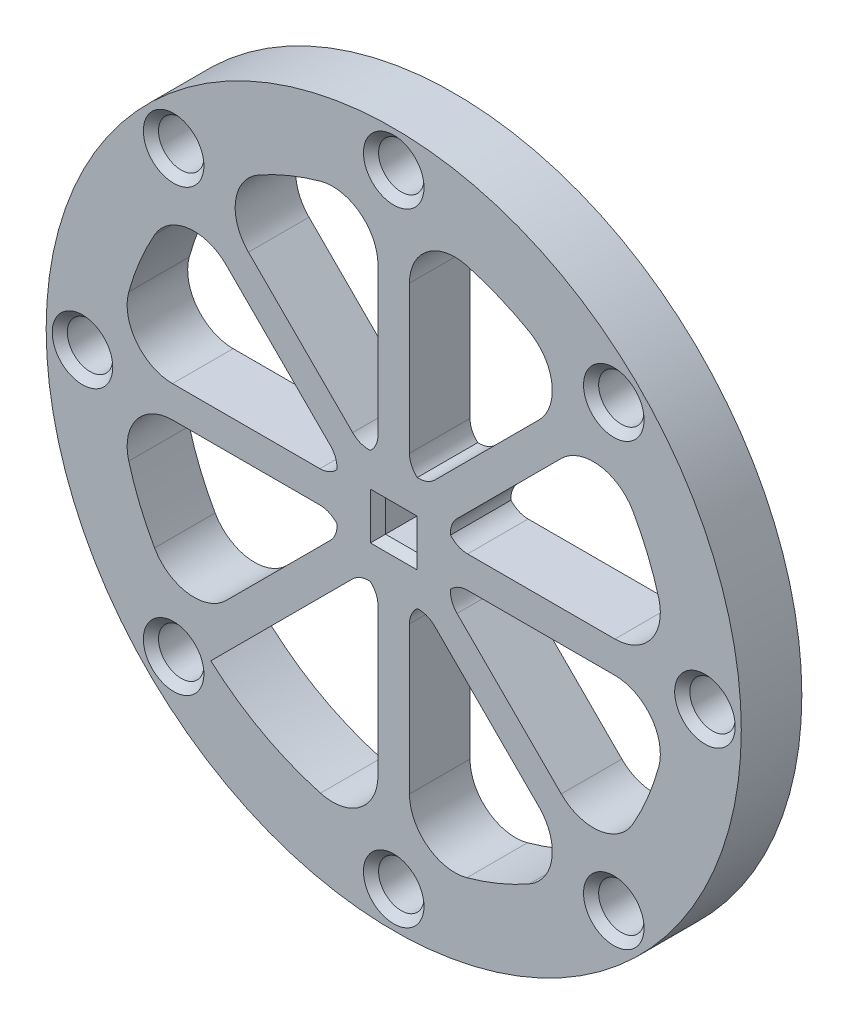
from build123d import *

# Parameters (mm, degrees)
SKETCH1_R           = 36.449
SKETCH1_W           = 3.302
SKETCH1_H           = 3.302
SKETCH1_R_2         = 2.38125
BOSS_EXTRUDE1_DEPTH = 6.35
FILLET1_R           = 4.7625
FILLET2_R           = 2.38125
CHAMFER1_SIZE       = 0.79375


with BuildPart() as part:
    # Sketch1 → Boss-Extrude1 (new body)
    with BuildSketch(Plane.XY):
        Circle(SKETCH1_R)
        with BuildLine():
            Line((-1.651, 28.781685844), (-1.651, 6.131614714))
            ThreePointArc((-1.651, 6.131614714), (-2.430039796, 5.866635031), (-3.168273048, 5.50313964))
            Line((-3.168273048, 5.50313964), (-19.184291938, 21.51915853))
            ThreePointArc((-19.184291938, 21.51915853), (-11.032380672, 26.634523043), (-1.651, 28.781685844))
        make_face(mode=Mode.SUBTRACT)
        with BuildLine():
            Line((-21.51915853, 19.184291938), (-5.50313964, 3.168273048))
            ThreePointArc((-5.50313964, 3.168273048), (-5.866635031, 2.430039796), (-6.131614714, 1.651))
            Line((-6.131614714, 1.651), (-28.781685844, 1.651))
            ThreePointArc((-28.781685844, 1.651), (-26.634523043, 11.032380672), (-21.51915853, 19.184291938))
        make_face(mode=Mode.SUBTRACT)
        with BuildLine():
            Line((-28.781685844, -1.651), (-6.131614714, -1.651))
            ThreePointArc((-6.131614714, -1.651), (-5.866635031, -2.430039796), (-5.50313964, -3.168273048))
            Line((-5.50313964, -3.168273048), (-21.51915853, -19.184291938))
            ThreePointArc((-21.51915853, -19.184291938), (-26.634523043, -11.032380672), (-28.781685844, -1.651))
        make_face(mode=Mode.SUBTRACT)
        with BuildLine():
            Line((-19.184291938, -21.51915853), (-3.168273048, -5.50313964))
            ThreePointArc((-3.168273048, -5.50313964), (-2.430039796, -5.866635031), (-1.651, -6.131614714))
            Line((-1.651, -6.131614714), (-1.651, -28.781685844))
            ThreePointArc((-1.651, -28.781685844), (-11.032380672, -26.634523043), (-19.184291938, -21.51915853))
        make_face(mode=Mode.SUBTRACT)
        with BuildLine():
            Line((1.651, -28.781685844), (1.651, -6.131614714))
            ThreePointArc((1.651, -6.131614714), (2.430039796, -5.866635031), (3.168273048, -5.50313964))
            Line((3.168273048, -5.50313964), (19.184291938, -21.51915853))
            ThreePointArc((19.184291938, -21.51915853), (11.032380672, -26.634523043), (1.651, -28.781685844))
        make_face(mode=Mode.SUBTRACT)
        with BuildLine():
            Line((21.51915853, -19.184291938), (5.50313964, -3.168273048))
            ThreePointArc((5.50313964, -3.168273048), (5.866635031, -2.430039796), (6.131614714, -1.651))
            Line((6.131614714, -1.651), (28.781685844, -1.651))
            ThreePointArc((28.781685844, -1.651), (26.634523043, -11.032380672), (21.51915853, -19.184291938))
        make_face(mode=Mode.SUBTRACT)
        with BuildLine():
            Line((28.781685844, 1.651), (6.131614714, 1.651))
            ThreePointArc((6.131614714, 1.651), (5.866635031, 2.430039796), (5.50313964, 3.168273048))
            Line((5.50313964, 3.168273048), (21.51915853, 19.184291938))
            ThreePointArc((21.51915853, 19.184291938), (26.634523043, 11.032380672), (28.781685844, 1.651))
        make_face(mode=Mode.SUBTRACT)
        with BuildLine():
            Line((19.184291938, 21.51915853), (3.168273048, 5.50313964))
            ThreePointArc((3.168273048, 5.50313964), (2.430039796, 5.866635031), (1.651, 6.131614714))
            Line((1.651, 6.131614714), (1.651, 28.781685844))
            ThreePointArc((1.651, 28.781685844), (11.032380672, 26.634523043), (19.184291938, 21.51915853))
        make_face(mode=Mode.SUBTRACT)
        Rectangle(SKETCH1_W, SKETCH1_H, mode=Mode.SUBTRACT)
        with Locations((-23.079258231, -23.079258231)):
            Circle(SKETCH1_R_2, mode=Mode.SUBTRACT)
        with Locations((-32.639, 0)):
            Circle(SKETCH1_R_2, mode=Mode.SUBTRACT)
        with Locations((0, -32.639)):
            Circle(SKETCH1_R_2, mode=Mode.SUBTRACT)
        with Locations((23.079258231, -23.079258231)):
            Circle(SKETCH1_R_2, mode=Mode.SUBTRACT)
        with Locations((-23.079258231, 23.079258231)):
            Circle(SKETCH1_R_2, mode=Mode.SUBTRACT)
        with Locations((23.079258231, 23.079258231)):
            Circle(SKETCH1_R_2, mode=Mode.SUBTRACT)
        with Locations((0, 32.639)):
            Circle(SKETCH1_R_2, mode=Mode.SUBTRACT)
        with Locations((32.639, 0)):
            Circle(SKETCH1_R_2, mode=Mode.SUBTRACT)
    extrude(amount=BOSS_EXTRUDE1_DEPTH)

    # Fillet1
    fillet1_edges = [part.edges().sort_by_distance(p)[0] for p in [
        (21.51915853, 19.184291938, 3.175),
        (28.781685844, 1.651, 3.175),
        (19.184291938, 21.51915853, 3.175),
        (1.651, 28.781685844, 3.175),
        (-1.651, 28.781685844, 3.175),
        (-19.184291938, 21.51915853, 3.175),
        (-21.51915853, 19.184291938, 3.175),
        (-28.781685844, 1.651, 3.175),
        (-28.781685844, -1.651, 3.175),
        (-21.51915853, -19.184291938, 3.175),
        (-1.651, -28.781685844, 3.175),
        (1.651, -28.781685844, 3.175),
        (19.184291938, -21.51915853, 3.175),
        (21.51915853, -19.184291938, 3.175),
        (28.781685844, -1.651, 3.175),
    ]]
    fillet(fillet1_edges, radius=FILLET1_R)

    # Fillet2
    # the kernel refuses this fillet: 2.38125 mm, written as the material it adds along each edge
    with BuildSketch(Plane(origin=(6.131614714, -1.651, 0), x_dir=(-0.36304434778587014, -0.931771861316241, 0), z_dir=(0, 0, 1)), Plane(origin=(1.651, 6.131614714, 0), x_dir=(0.9317718613162208, -0.36304434778592154, 0), z_dir=(0, 0, 1)), Plane(origin=(5.50313964, 3.168273048, 0), x_dir=(0.40215108146465606, -0.9155733218463759, 0), z_dir=(0, 0, 1)), Plane(origin=(-6.131614714, 1.651, 0), x_dir=(0.3630443477859294, 0.9317718613162179, 0), z_dir=(0, 0, 1))) as fillet2_piece_1:
        with BuildLine():
            CenterArc((1.633270214, 2.367244602), FILLET2_R, 201.287277983, 62.495506179)
            Line((-0.585511531, 1.502745249), (0, 0))
            ThreePointArc((0, 0), (0.687692722, 0.037347727), (1.375385443, 0))
        make_face()
    extrude(amount=6.35)
    with BuildSketch(Plane(origin=(5.50313964, -3.168273048, 0), x_dir=(0.7071067811865454, -0.7071067811865497, 0), z_dir=(0, 0, 1)), Plane(origin=(3.168273048, 5.50313964, 0), x_dir=(0.7071067811865503, 0.7071067811865448, 0), z_dir=(0, 0, 1)), Plane(origin=(6.131614714, 1.651, 0), x_dir=(1, 0, 0), z_dir=(0, 0, 1)), Plane(origin=(-1.651, 6.131614714, 0), x_dir=(0, 1, 0), z_dir=(0, 0, 1)), Plane(origin=(-5.50313964, 3.168273048, 0), x_dir=(-0.7071067811865499, 0.7071067811865452, 0), z_dir=(0, 0, 1)), Plane(origin=(-6.131614714, -1.651, 0), x_dir=(-1, 0, 0), z_dir=(0, 0, 1)), Plane(origin=(1.651, -6.131614714, 0), x_dir=(0, -1, 0), z_dir=(0, 0, 1))) as fillet2_piece_2:
        with BuildLine():
            CenterArc((1.61278239, 2.38125), FILLET2_R, 207.504493821, 62.495506179)
            ThreePointArc((-0.499325911, 1.281545455), (-0.214863395, 0.654331608), (0, 0))
            Line((0, 0), (1.61278239, 0))
        make_face()
    extrude(amount=6.35)
    with BuildSketch(Plane(origin=(3.168273048, -5.50313964, 0), x_dir=(0.7071067811865439, -0.7071067811865511, 0), z_dir=(0, 0, 1)), Plane(origin=(-3.168273048, 5.50313964, 0), x_dir=(-0.7071067811865503, 0.7071067811865448, 0), z_dir=(0, 0, 1)), Plane(origin=(-5.50313964, -3.168273048, 0), x_dir=(-0.7071067811865455, -0.7071067811865496, 0), z_dir=(0, 0, 1)), Plane(origin=(-1.651, -6.131614714, 0), x_dir=(0, -1, 0), z_dir=(0, 0, 1))) as fillet2_piece_3:
        with BuildLine():
            CenterArc((1.61278239, -2.38125), FILLET2_R, 90, 62.495506179)
            ThreePointArc((-0.499325911, -1.281545455), (-0.214863395, -0.654331608), (0, 0))
            Line((0, 0), (1.61278239, 0))
        make_face()
    extrude(amount=6.35)
    with BuildSketch(Plane(origin=(-3.168273048, -5.50313964, 0), x_dir=(0.9155733218463795, -0.40215108146464806, 0), z_dir=(0, 0, 1))) as fillet2_piece_4:
        with BuildLine():
            CenterArc((1.633270214, -2.367244602), FILLET2_R, 96.217215838, 62.495506179)
            Line((-0.585511531, -1.502745249), (0, 0))
            ThreePointArc((0, 0), (0.687692722, -0.037347727), (1.375385443, 0))
        make_face()
    extrude(amount=6.35)

    # Chamfer1
    chamfer1_edges = [part.edges().sort_by_distance(p)[0] for p in [
        (-25.460508231, 23.079258231, 6.35),
        (-35.02025, 0, 6.35),
        (-25.460508231, -23.079258231, 6.35),
        (-2.38125, -32.639, 6.35),
        (20.698008231, -23.079258231, 6.35),
        (30.25775, 0, 6.35),
        (20.698008231, 23.079258231, 6.35),
        (-2.38125, 32.639, 6.35),
        (0, -1.651, 6.35),
        (-1.651, 0, 6.35),
        (0, 1.651, 6.35),
        (1.651, 0, 6.35),
        (1.651, 0, 0),
        (0, 1.651, 0),
        (-1.651, 0, 0),
        (0, -1.651, 0),
        (-2.38125, 32.639, 0),
        (20.698008231, 23.079258231, 0),
        (30.25775, 0, 0),
        (20.698008231, -23.079258231, 0),
        (-2.38125, -32.639, 0),
        (-25.460508231, -23.079258231, 0),
        (-35.02025, 0, 0),
        (-25.460508231, 23.079258231, 0),
    ]]
    chamfer(chamfer1_edges, length=CHAMFER1_SIZE)


solid = part.part
